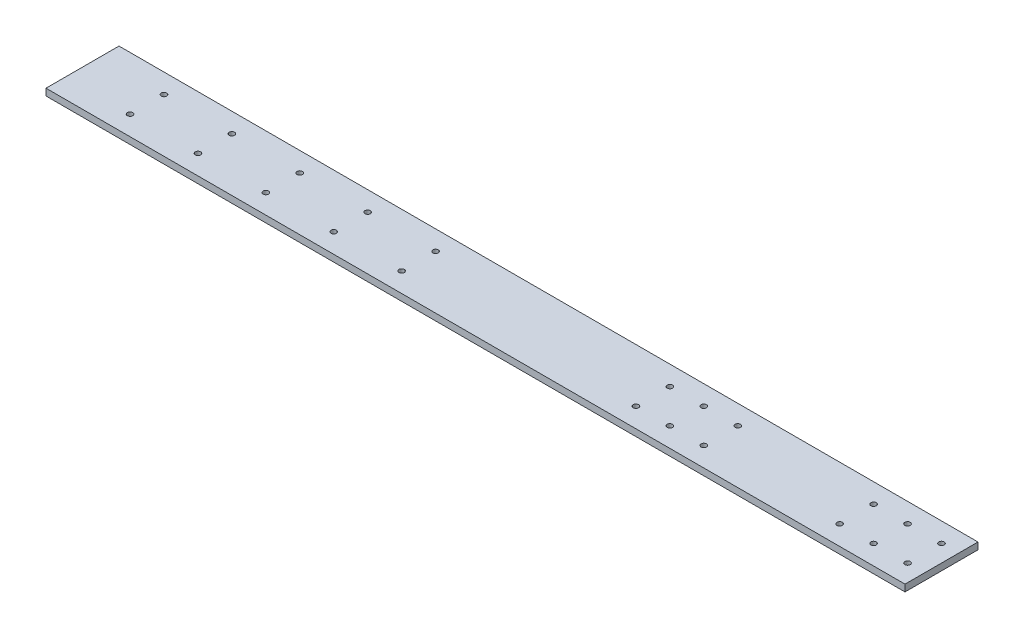
from build123d import *

# Parameters (mm, degrees)
SKETCH1_W           = 506
SKETCH1_H           = 43
SKETCH1_R           = 1.6
BOSS_EXTRUDE1_DEPTH = 4


with BuildPart() as part:
    # Sketch1 → Boss-Extrude1 (new body)
    with BuildSketch(Plane(origin=(0, 0, 0), x_dir=(1, 0, 0), z_dir=(0, 1, 0))):
        Rectangle(SKETCH1_W, SKETCH1_H)
        with Locations((-215, 10)):
            Circle(SKETCH1_R, mode=Mode.SUBTRACT)
        with Locations((-175, 10)):
            Circle(SKETCH1_R, mode=Mode.SUBTRACT)
        with Locations((-135, 10)):
            Circle(SKETCH1_R, mode=Mode.SUBTRACT)
        with Locations((-95, 10)):
            Circle(SKETCH1_R, mode=Mode.SUBTRACT)
        with Locations((-55, 10)):
            Circle(SKETCH1_R, mode=Mode.SUBTRACT)
        with Locations((-175, -10)):
            Circle(SKETCH1_R, mode=Mode.SUBTRACT)
        with Locations((-135, -10)):
            Circle(SKETCH1_R, mode=Mode.SUBTRACT)
        with Locations((-95, -10)):
            Circle(SKETCH1_R, mode=Mode.SUBTRACT)
        with Locations((-55, -10)):
            Circle(SKETCH1_R, mode=Mode.SUBTRACT)
        with Locations((-215, -10)):
            Circle(SKETCH1_R, mode=Mode.SUBTRACT)
        with Locations((223, 10)):
            Circle(SKETCH1_R, mode=Mode.SUBTRACT)
        with Locations((103, 10)):
            Circle(SKETCH1_R, mode=Mode.SUBTRACT)
        with Locations((103, -10)):
            Circle(SKETCH1_R, mode=Mode.SUBTRACT)
        with Locations((223, -10)):
            Circle(SKETCH1_R, mode=Mode.SUBTRACT)
        with Locations((123, -10)):
            Circle(SKETCH1_R, mode=Mode.SUBTRACT)
        with Locations((123, 10)):
            Circle(SKETCH1_R, mode=Mode.SUBTRACT)
        with Locations((243, 10)):
            Circle(SKETCH1_R, mode=Mode.SUBTRACT)
        with Locations((243, -10)):
            Circle(SKETCH1_R, mode=Mode.SUBTRACT)
        with Locations((83, -10)):
            Circle(SKETCH1_R, mode=Mode.SUBTRACT)
        with Locations((83, 10)):
            Circle(SKETCH1_R, mode=Mode.SUBTRACT)
        with Locations((203, 10)):
            Circle(SKETCH1_R, mode=Mode.SUBTRACT)
        with Locations((203, -10)):
            Circle(SKETCH1_R, mode=Mode.SUBTRACT)
    extrude(amount=BOSS_EXTRUDE1_DEPTH)


solid = part.part
